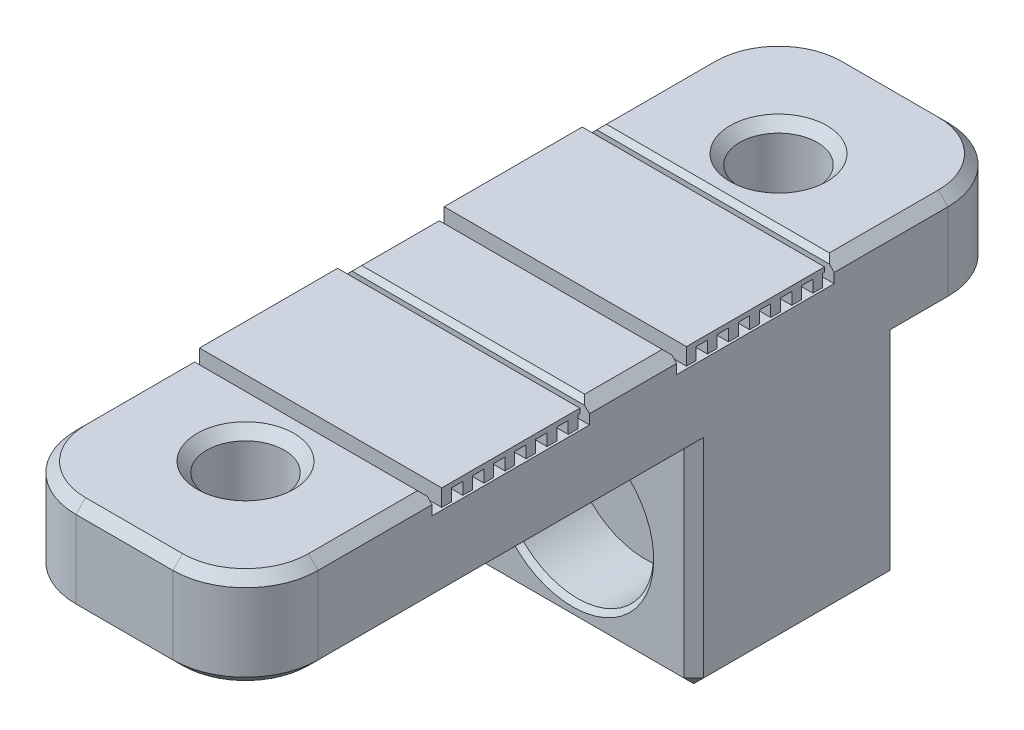
from build123d import *

# Parameters (mm, degrees)
SKETCH_1_W          = 10
SKETCH_1_H          = 32
SKETCH_1_R          = 1.6
EXTRUDE_1_DEPTH     = 4
SKETCH_2_W          = 10
SKETCH_2_H          = 8.5
EXTRUDE_2_DEPTH     = 8.6
SKETCH_3_R          = 3.15
CUT_EXTRUDE_1_DEPTH = 3
SKETCH_4_R          = 3
CUT_EXTRUDE_2_DEPTH = 35.611558763
SKETCH_5_W          = 10
SKETCH_5_H          = 6.5
CUT_EXTRUDE_3_DEPTH = 0.8
SKETCH_6_W          = 10
SKETCH_6_H          = 5.7
EXTRUDE_3_DEPTH     = 0.2
EXTRUDE_3_2_DEPTH   = 0.2
SKETCH_7_W          = 10
SKETCH_7_H          = 0.4
EXTRUDE_4_DEPTH     = 0.7
CUT_EXTRUDE_START   = -0.8
SKETCH_8_R          = 3
CUT_EXTRUDE_4_DEPTH = 0.8
FILLET_1_R          = 3
FILLET_3_R          = 1
CHAMFER_1_SIZE      = 0.2
CHAMFER_4_SIZE      = 0.4
CHAMFER_6_SIZE      = 0.2


with BuildPart() as part:
    # 草图1 → 凸台-拉伸1 (new body)
    with BuildSketch(Plane(origin=(0, 0, 0), x_dir=(1, 0, 0), z_dir=(0, 1, 0))):
        with Locations((5, 16)):
            Rectangle(SKETCH_1_W, SKETCH_1_H)
        with Locations(Location((5, 27, 0), (0, 0, 270))):
            Circle(SKETCH_1_R, mode=Mode.SUBTRACT)
        with Locations(Location((5, 5, 0), (0, 0, 270))):
            Circle(SKETCH_1_R, mode=Mode.SUBTRACT)
    extrude(amount=EXTRUDE_1_DEPTH)

    # 草图2 → 凸台-拉伸2 (add)
    with BuildSketch(Plane(origin=(0, 0, 0), x_dir=(-1, 0, 0), z_dir=(0, -1, 0))):
        with Locations((-5, 22.75)):
            Rectangle(SKETCH_2_W, SKETCH_2_H)
    extrude(amount=EXTRUDE_2_DEPTH)

    # 草图3 → 切除-拉伸1 (cut)
    with BuildSketch(Plane.XY.offset(-18.5)):
        with Locations((5, -4.6)):
            Circle(SKETCH_3_R)
    extrude(amount=-CUT_EXTRUDE_1_DEPTH, mode=Mode.SUBTRACT)

    # 草图4 → 切除-拉伸2 (cut, through all)
    with BuildSketch(Plane(origin=(0, 0, 0), x_dir=(-1, 0, 0), z_dir=(0, -1, 0))):
        with Locations((-5, 27)):
            Circle(SKETCH_4_R)
    extrude(amount=CUT_EXTRUDE_2_DEPTH, mode=Mode.SUBTRACT)

    # 草图5 → 切除-拉伸3 (cut)
    with BuildSketch(Plane(origin=(0, 4, 0), x_dir=(1, 0, 0), z_dir=(0, 1, 0))):
        with Locations((5, 21.05)):
            Rectangle(SKETCH_5_W, SKETCH_5_H)
        with Locations((5, 10.95)):
            Rectangle(SKETCH_5_W, SKETCH_5_H)
    extrude(amount=-CUT_EXTRUDE_3_DEPTH, mode=Mode.SUBTRACT)

    # 草图8 → 切除-拉伸4 (cut)
    with BuildSketch(Plane(origin=(0, 0, 0), x_dir=(-1, 0, 0), z_dir=(0, -1, 0)).offset(CUT_EXTRUDE_START)):
        with Locations(Location((-5, 5, 0), (0, 0, 90))):
            Circle(SKETCH_8_R)
        with Locations((-5, 27)):
            Circle(SKETCH_8_R)
    extrude(amount=CUT_EXTRUDE_4_DEPTH, mode=Mode.SUBTRACT)

    # 圆角1
    fillet_1_edges = [part.edges().sort_by_distance(p)[0] for p in [
        (0, 2, -32),
        (10, 2, -32),
        (10, 2, 0),
        (0, 2, 0),
    ]]
    fillet(fillet_1_edges, radius=FILLET_1_R)

    # 圆角3
    # the kernel refuses this fillet: 1 mm, written as the material it takes off along each edge
    with BuildSketch(Plane(origin=(8, -10.782458366, -27), x_dir=(1, 0, 0), z_dir=(0, 1, 0)), Plane(origin=(2, 0, -27), x_dir=(-1, 0, 0), z_dir=(0, -1, 0))) as fillet_3_piece_1:
        with BuildLine():
            CenterArc((0.872983346, -1), FILLET_3_R, 90, 75.522487814)
            ThreePointArc((-0.09526249, -0.75), (-0.023910911, -0.378012877), (0, 0))
            Line((0, 0), (0.872983346, 0))
        make_face()
    extrude(amount=10.782458366, mode=Mode.SUBTRACT)

    # 倒角1
    chamfer_1_edges = [part.edges().sort_by_distance(p)[0] for p in [
        (5, 4, -17.8),
        (5, 4, -24.3),
        (5, 4, -7.7),
        (5, 4, -14.2),
    ]]
    chamfer(chamfer_1_edges, length=CHAMFER_1_SIZE)

    # 倒角4
    chamfer_4_edges = [part.edges().sort_by_distance(p)[0] for p in [
        (10, 4, -26.75),
        (0, 4, -26.75),
        (10, 4, -16),
        (0, 4, -16),
        (5, 4, -6.6),
        (0, 4, -5.25),
        (10, 4, -5.25),
        (0.878679656, 4, -0.878679656),
        (9.121320344, 4, -0.878679656),
        (5, 4, 0),
        (5, 4, -28.6),
        (5, 0, -2),
        (10, 0, -10.75),
        (9.121320344, 0, -0.878679656),
        (5, 0, 0),
        (0.878679656, 0, -0.878679656),
        (10, -4.3, -27),
        (0, 0, -10.75),
        (10, -4.3, -18.5),
        (10, -8.6, -22.75),
        (5, -8.6, -18.5),
        (0, -4.3, -18.5),
        (0, -8.6, -22.75),
        (0, -4.3, -27),
        (0, 0, -28),
        (10, 0, -28),
        (5, 0, -32),
        (5, 4, -32),
        (9.121320344, 0, -31.121320344),
        (0.878679656, 0, -31.121320344),
        (9.121320344, 4, -31.121320344),
        (0.878679656, 4, -31.121320344),
    ]]
    chamfer(chamfer_4_edges, length=CHAMFER_4_SIZE)

    # 倒角6
    chamfer_6_edges = [part.edges().sort_by_distance(p)[0] for p in [
        (1.85, -4.6, -18.5),
    ]]
    chamfer(chamfer_6_edges, length=CHAMFER_6_SIZE)


with BuildPart() as body_2:
    # 草图6 → 凸台-拉伸3 (new body)
    with BuildSketch(Plane(origin=(0, 4, 0), x_dir=(1, 0, 0), z_dir=(0, 1, 0))):
        with Locations((5, 10.95)):
            Rectangle(SKETCH_6_W, SKETCH_6_H)
    extrude(amount=-EXTRUDE_3_DEPTH)



with BuildPart() as body_3:
    # 草图6 → Extrude 3 2 (new body)
    with BuildSketch(Plane(origin=(0, 4, 0), x_dir=(1, 0, 0), z_dir=(0, 1, 0))):
        with Locations((5, 21.05)):
            Rectangle(SKETCH_6_W, SKETCH_6_H)
    extrude(amount=-EXTRUDE_3_2_DEPTH)


with BuildPart() as body_2_1:
    add(body_2.part)

    add(body_3.part)  # 凸台-拉伸4 merges body 3
    # 草图7 → 凸台-拉伸4 (add)
    with BuildSketch(Plane(origin=(0, 4, 0), x_dir=(1, 0, 0), z_dir=(0, 1, 0))):
        with Locations((5, 8.3)):
            Rectangle(SKETCH_7_W, SKETCH_7_H)
        with Locations((5, 18.4)):
            Rectangle(SKETCH_7_W, SKETCH_7_H)
        with Locations((5, 19.27)):
            Rectangle(SKETCH_7_W, SKETCH_7_H)
        with Locations((5, 9.17)):
            Rectangle(SKETCH_7_W, SKETCH_7_H)
        with Locations((5, 20.14)):
            Rectangle(SKETCH_7_W, SKETCH_7_H)
        with Locations((5, 10.04)):
            Rectangle(SKETCH_7_W, SKETCH_7_H)
        with Locations((5, 21.01)):
            Rectangle(SKETCH_7_W, SKETCH_7_H)
        with Locations((5, 10.91)):
            Rectangle(SKETCH_7_W, SKETCH_7_H)
        with Locations((5, 21.88)):
            Rectangle(SKETCH_7_W, SKETCH_7_H)
        with Locations((5, 11.78)):
            Rectangle(SKETCH_7_W, SKETCH_7_H)
        with Locations((5, 22.75)):
            Rectangle(SKETCH_7_W, SKETCH_7_H)
        with Locations((5, 12.65)):
            Rectangle(SKETCH_7_W, SKETCH_7_H)
        with Locations((5, 23.62)):
            Rectangle(SKETCH_7_W, SKETCH_7_H)
        with Locations((5, 13.52)):
            Rectangle(SKETCH_7_W, SKETCH_7_H)
    extrude(amount=-EXTRUDE_4_DEPTH)


solid = Compound([part.part, body_2_1.part])
